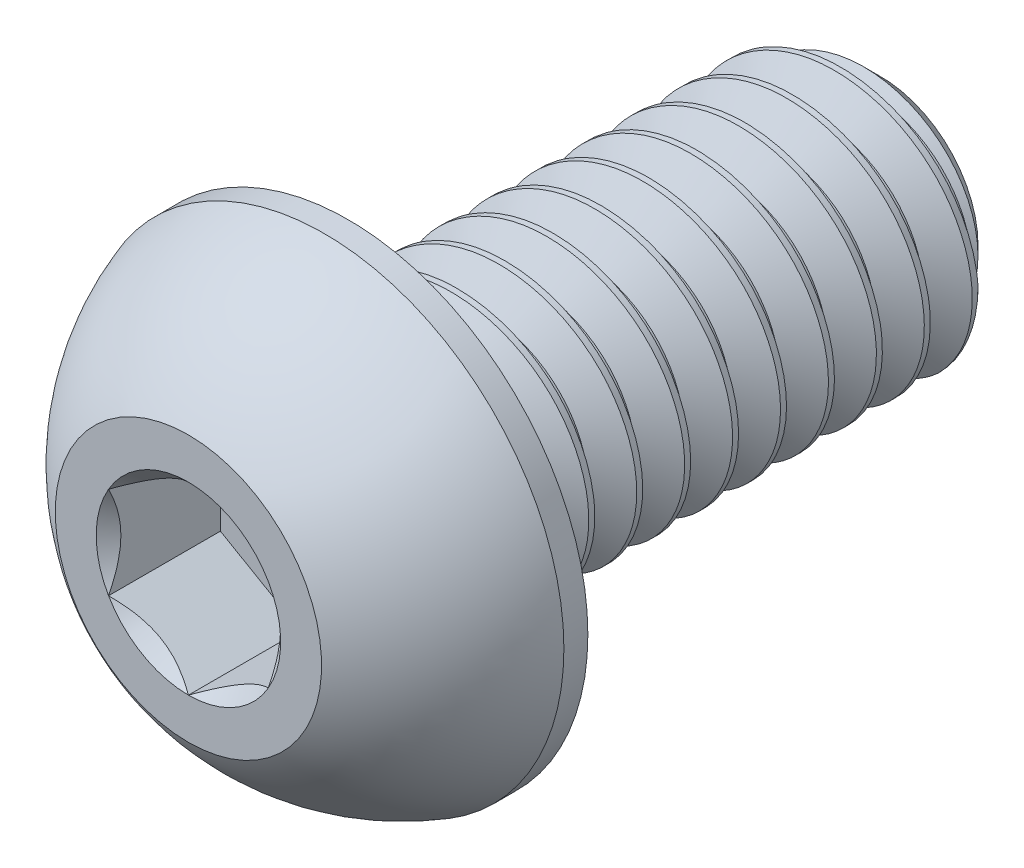
from build123d import *

# Parameters (mm, degrees)
CUT_EXTRUDE2_DEPTH = 1.05
CUT_SWEEP2_PITCH   = 0.45


# Read off the part's stored shape, not the designer's step: Split1, Boss-Extrude1
with BuildPart() as part:
    # Sketch10 → Revolve3 (revolve)
    with BuildSketch(Plane(origin=(0, 0, 0), x_dir=(0, 0, -1), z_dir=(1, 0, 0)), mode=Mode.PRIVATE) as revolve3_sk:
        Polygon((6.1625, 1.25), (6.5, 0.9125), (6.5, 0), (1.5, 0), (1.5, 1.25), align=None)
    revolve(revolve3_sk.sketch.rotate(Axis((0, 0, 0), (0, 0, -1)), 90), axis=Axis((0, 0, 0), (0, 0, -1)))

    # Sketch7 → Revolve2 (revolve)
    with BuildSketch(Plane(origin=(0, 0, 0), x_dir=(0, 0, -1), z_dir=(1, 0, 0)), mode=Mode.PRIVATE) as revolve2_sk:
        with BuildLine():
            Line((1.275, 2.25), (1.5, 2.25))
            Line((1.5, 2.25), (1.5, 0))
            Line((1.5, 0), (0, 0))
            Line((0, 0), (0, 1.25))
            ThreePointArc((0, 1.25), (0.549264706, 1.8625), (1.275, 2.25))
        make_face()
    revolve(revolve2_sk.sketch.rotate(Axis((0, 0, 0), (0, 0, -1)), 180), axis=Axis((0, 0, 0), (0, 0, -1)))

    # Sketch5 → Cut-Extrude2 (cut)
    with BuildSketch(Plane.XY):
        Polygon((0.75, -0.433012702), (0.75, 0.433012702), (0, 0.866025404), (-0.75, 0.433012702), (-0.75, -0.433012702), (0, -0.866025404), align=None)
    extrude(amount=-CUT_EXTRUDE2_DEPTH, mode=Mode.SUBTRACT)

    # Cut-Extrude3 cone 1 section (through the dimple's axis) → Cut-Extrude3 (revolve, cut)
    with BuildSketch(Plane(origin=(0, 0, 0), x_dir=(0, -1, 0), z_dir=(1, 0, 0))):
        Polygon((0, 0), (0.866025404, 0), (0, 0.866025404), align=None)
    revolve(axis=Axis((0, 0, 0), (0, 0, -1)), mode=Mode.SUBTRACT)


with BuildPart() as body_2:
    # Split1: the piece on the far side of the plane
    add(part.part)
    split(bisect_by=Plane.XY.offset(-1.5), keep=Keep.BOTTOM)

    # Cut-Sweep2: the profile of Sketch12 screwed along a right-hand helix of 14.444444 turns, 6 arcs to a turn; built about Z, then put on its axis
    cut_sweep2_z = Axis((0, 0, 0), (0, 0, 1))
    cut_sweep2_corners = [(0.957716426, 0, -0.16875), (0.957716426, 0, -0.225), (1.274356964, 0, -0.4078125), (1.274356964, 0, 0.0140625)]
    with BuildLine(mode=Mode.PRIVATE) as cut_sweep2_profile:
        Line(cut_sweep2_corners[0], cut_sweep2_corners[1])
        Line(cut_sweep2_corners[1], cut_sweep2_corners[2])
        Line(cut_sweep2_corners[2], cut_sweep2_corners[3])
        Line(cut_sweep2_corners[3], cut_sweep2_corners[0])
    cut_sweep2_cap = Face(cut_sweep2_profile.wire())
    cut_sweep2_turn_angles = [0, 30, 60, 90, 120, 150, 180, 210, 240, 270, 300, 330, 360]
    cut_sweep2_turn_weights = [1, 0.8660254037844387, 1, 0.8660254037844387, 1, 0.8660254037844387, 1, 0.8660254037844387, 1, 0.8660254037844387, 1, 0.8660254037844387, 1]
    cut_sweep2_turn_rails = [Edge.make_bspline([Vector(p[0], p[1], 0).rotate(cut_sweep2_z, cut_sweep2_turn_angles[k]) / cut_sweep2_turn_weights[k] + Vector(0, 0, p[2] + CUT_SWEEP2_PITCH * cut_sweep2_turn_angles[k] / 360) for k in range(13)], [0, 0, 0, 1, 1, 2, 2, 3, 3, 4, 4, 5, 5, 6, 6, 6], 2, cut_sweep2_turn_weights) for p in cut_sweep2_corners]
    cut_sweep2_turn_sides = [Face.make_surface_from_curves(cut_sweep2_turn_rails[p[0]], cut_sweep2_turn_rails[p[1]]) for p in [(0, 1), (1, 2), (2, 3), (3, 0)]]
    cut_sweep2_turn = Solid(Shell([*cut_sweep2_turn_sides, cut_sweep2_cap, cut_sweep2_cap.rotate(cut_sweep2_z, 360).moved(Location((0, 0, CUT_SWEEP2_PITCH * 360 / 360)))]))
    cut_sweep2_last_angles = [5040, 5070, 5100, 5130, 5160, 5180, 5200]
    cut_sweep2_last_weights = [1, 0.8660254037844387, 1, 0.8660254037844387, 1, 0.9396926207858731, 1]
    cut_sweep2_last_rails = [Edge.make_bspline([Vector(p[0], p[1], 0).rotate(cut_sweep2_z, cut_sweep2_last_angles[k]) / cut_sweep2_last_weights[k] + Vector(0, 0, p[2] + CUT_SWEEP2_PITCH * cut_sweep2_last_angles[k] / 360) for k in range(7)], [0, 0, 0, 1, 1, 2, 2, 3, 3, 3], 2, cut_sweep2_last_weights) for p in cut_sweep2_corners]
    cut_sweep2_last_sides = [Face.make_surface_from_curves(cut_sweep2_last_rails[p[0]], cut_sweep2_last_rails[p[1]]) for p in [(0, 1), (1, 2), (2, 3), (3, 0)]]
    cut_sweep2_last = Solid(Shell([*cut_sweep2_last_sides, cut_sweep2_cap.rotate(cut_sweep2_z, 5040).moved(Location((0, 0, CUT_SWEEP2_PITCH * 5040 / 360))), cut_sweep2_cap.rotate(cut_sweep2_z, 5200).moved(Location((0, 0, CUT_SWEEP2_PITCH * 5200 / 360)))]))
    cut_sweep2_each = [*[cut_sweep2_turn.moved(Location((0, 0, CUT_SWEEP2_PITCH * i))) for i in range(14)], cut_sweep2_last]
    add(Plane(origin=(0, 0, -6.5), x_dir=(0, 1, 0), z_dir=(0, 0, 1)) * Compound([cut_sweep2_each[i] for i in range(0, 15, 2)]), mode=Mode.SUBTRACT)
    add(Plane(origin=(0, 0, -6.5), x_dir=(0, 1, 0), z_dir=(0, 0, 1)) * Compound([cut_sweep2_each[i] for i in range(1, 15, 2)]), mode=Mode.SUBTRACT)


with BuildPart() as part_1:
    add(part.part)

    # Split1
    split(bisect_by=Plane.XY.offset(-1.5), keep=Keep.TOP)

    add(body_2.part)  # Boss-Extrude1 merges body 2
    # Boss-Extrude1 outline → Boss-Extrude1 (revolve)
    with BuildSketch(Plane.XZ):
        Polygon((0.957716426, -1.5), (0.957716426, -1.792283574), (1.25, -1.5), align=None)
    revolve(axis=Axis((0, 0, 0), (0, 0, 1)))


solid = part_1.part
